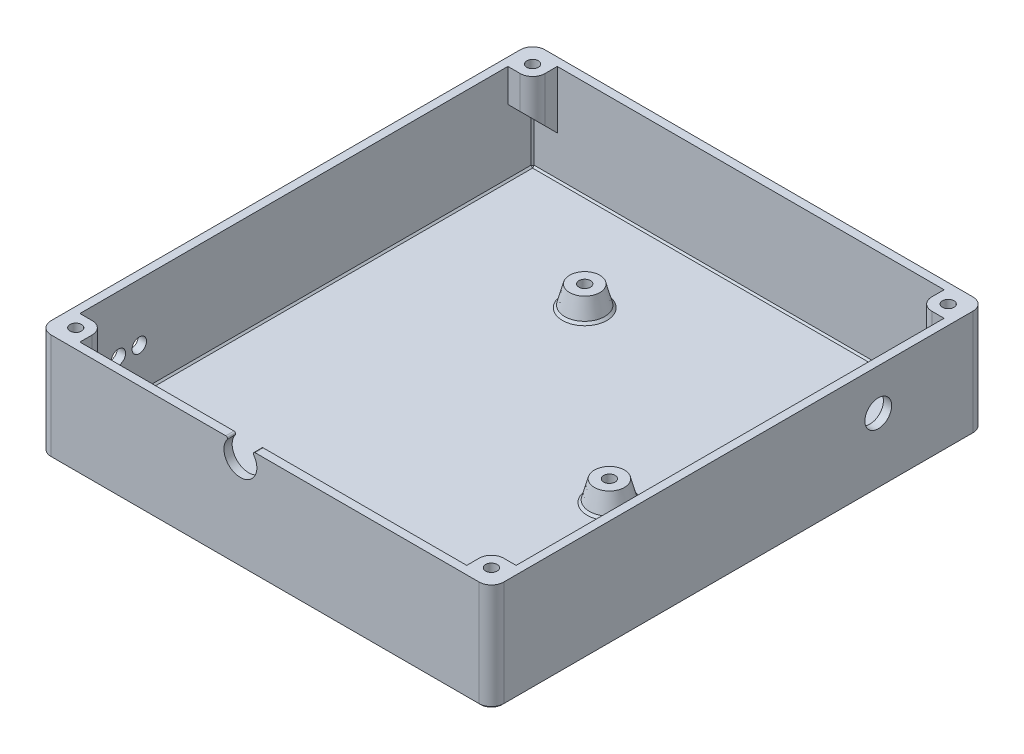
from build123d import *
from OCP.BRepFilletAPI import BRepFilletAPI_MakeChamfer

# Parameters (mm, degrees)
SKETCH_1_W                = 110
SKETCH_1_H                = 120
EXTRUDE_1_DEPTH           = 2
SKETCH_2_R                = 5
EXTRUDE_2_DEPTH           = 5
EXTRUDE_2_DRAFT           = 15
EXTRUDE_2_PROFILE_2_DEPTH = 5
EXTRUDE_2_PROFILE_2_DRAFT = 15
EXTRUDE_2_PROFILE_3_DEPTH = 5
EXTRUDE_2_PROFILE_3_DRAFT = 15
SKETCH_3_R                = 1.4
CUT_EXTRUDE_1_DEPTH       = 5
SKETCH_4_W                = 110
SKETCH_4_H                = 120
SKETCH_4_W_2              = 106
SKETCH_4_H_2              = 116
EXTRUDE_3_DEPTH           = 24
SKETCH_5_W                = 6
SKETCH_5_H                = 6
EXTRUDE_4_DEPTH           = 8
CHAMFER_1_SIZE            = 6
SKETCH_6_R                = 1.4
CUT_EXTRUDE_2_DEPTH       = 8
FILLET_1_R                = 3
CHAMFER_2_SIZE            = 0.4
CHAMFER_3_SIZE            = 0.4
CHAMFER_3_SIZE2           = 0.565685425
SKETCH_8_R                = 4
CUT_EXTRUDE_3_DEPTH       = 3
FILLET_2_R                = 0.4
SKETCH_9_R                = 3.25
CUT_EXTRUDE_4_DEPTH       = 10
SKETCH_10_R               = 1.75
CUT_EXTRUDE_5_DEPTH       = 10


with BuildPart() as part:
    # 草图1 → 凸台-拉伸1 (new body)
    with BuildSketch(Plane(origin=(0, 0, 0), x_dir=(1, 0, 0), z_dir=(0, 1, 0))):
        with Locations((55, 60)):
            Rectangle(SKETCH_1_W, SKETCH_1_H)
    extrude(amount=EXTRUDE_1_DEPTH)


with BuildPart() as extrude_2_tool:
    # 草图2 → 凸台-拉伸2 (with draft: the straight prism first)
    with BuildSketch(Plane(origin=(0, 2, 0), x_dir=(1, 0, 0), z_dir=(0, 1, 0))):
        with Locations((82.1, 56.57)):
            Circle(SKETCH_2_R)
    extrude(amount=EXTRUDE_2_DEPTH)
    # 凸台-拉伸2: the draft: its side faces are tilted about the plane it starts from
    extrude_2_sides = [extrude_2_tool.faces().sort_by_distance(p)[0] for p in [
        (77.1, 4.5, -56.57),
    ]]
    draft(extrude_2_sides, Plane(origin=(0, 2, 0), x_dir=(1, 0, 0), z_dir=(0, 1, 0)), EXTRUDE_2_DRAFT)


with BuildPart() as part_1:
    add(part.part)

    # 凸台-拉伸2: add extrude_2_tool
    add(extrude_2_tool.part)


with BuildPart() as extrude_2_profile_2_tool:
    # 草图2 → 凸台-拉伸2 profile 2 (with draft: the straight prism first)
    with BuildSketch(Plane(origin=(0, 2, 0), x_dir=(1, 0, 0), z_dir=(0, 1, 0))):
        with Locations((38.1, 94.57)):
            Circle(SKETCH_2_R)
    extrude(amount=EXTRUDE_2_PROFILE_2_DEPTH)
    # 凸台-拉伸2 profile 2: the draft: its side faces are tilted about the plane it starts from
    extrude_2_profile_2_sides = [extrude_2_profile_2_tool.faces().sort_by_distance(p)[0] for p in [
        (33.1, 4.5, -94.57),
    ]]
    draft(extrude_2_profile_2_sides, Plane(origin=(0, 2, 0), x_dir=(1, 0, 0), z_dir=(0, 1, 0)), EXTRUDE_2_PROFILE_2_DRAFT)


with BuildPart() as part_2:
    add(part_1.part)

    # 凸台-拉伸2 profile 2: add extrude_2_profile_2_tool
    add(extrude_2_profile_2_tool.part)


with BuildPart() as extrude_2_profile_3_tool:
    # 草图2 → 凸台-拉伸2 profile 3 (with draft: the straight prism first)
    with BuildSketch(Plane(origin=(0, 2, 0), x_dir=(1, 0, 0), z_dir=(0, 1, 0))):
        with Locations((23.1, 13.57)):
            Circle(SKETCH_2_R)
    extrude(amount=EXTRUDE_2_PROFILE_3_DEPTH)
    # 凸台-拉伸2 profile 3: the draft: its side faces are tilted about the plane it starts from
    extrude_2_profile_3_sides = [extrude_2_profile_3_tool.faces().sort_by_distance(p)[0] for p in [
        (18.1, 4.5, -13.57),
    ]]
    draft(extrude_2_profile_3_sides, Plane(origin=(0, 2, 0), x_dir=(1, 0, 0), z_dir=(0, 1, 0)), EXTRUDE_2_PROFILE_3_DRAFT)


with BuildPart() as part_3:
    add(part_2.part)

    # 凸台-拉伸2 profile 3: add extrude_2_profile_3_tool
    add(extrude_2_profile_3_tool.part)

    # 草图3 → 切除-拉伸1 (cut)
    with BuildSketch(Plane(origin=(0, 7, 0), x_dir=(1, 0, 0), z_dir=(0, 1, 0))):
        with Locations(Location((82.1, 56.57, 0), (0, 0, 270))):
            Circle(SKETCH_3_R)
        with Locations(Location((38.1, 94.57, 0), (0, 0, 270))):
            Circle(SKETCH_3_R)
        with Locations(Location((23.1, 13.57, 0), (0, 0, 270))):
            Circle(SKETCH_3_R)
    extrude(amount=-CUT_EXTRUDE_1_DEPTH, mode=Mode.SUBTRACT)

    # 草图4 → 凸台-拉伸3 (add)
    with BuildSketch(Plane(origin=(0, 2, 0), x_dir=(1, 0, 0), z_dir=(0, 1, 0))):
        with Locations((55, 60)):
            Rectangle(SKETCH_4_W, SKETCH_4_H)
        with Locations((55, 60)):
            Rectangle(SKETCH_4_W_2, SKETCH_4_H_2, mode=Mode.SUBTRACT)
    extrude(amount=EXTRUDE_3_DEPTH)

    # 草图5 → 凸台-拉伸4 (add)
    with BuildSketch(Plane(origin=(0, 26, 0), x_dir=(1, 0, 0), z_dir=(0, 1, 0))):
        with Locations((5, 115)):
            Rectangle(SKETCH_5_W, SKETCH_5_H)
        with Locations((105, 115)):
            Rectangle(SKETCH_5_W, SKETCH_5_H)
        with Locations((105, 5)):
            Rectangle(SKETCH_5_W, SKETCH_5_H)
        with Locations((5, 5)):
            Rectangle(SKETCH_5_W, SKETCH_5_H)
    extrude(amount=-EXTRUDE_4_DEPTH)

    # 倒角1
    chamfer_1_edges = [part_3.edges().sort_by_distance(p)[0] for p in [
        (105, 18, -118),
        (5, 18, -118),
        (105, 18, -2),
        (5, 18, -2),
    ]]
    chamfer(chamfer_1_edges, length=CHAMFER_1_SIZE - 0.0001)  # a hair under: the kernel refuses the full size

    # 草图6 → 切除-拉伸2 (cut)
    with BuildSketch(Plane(origin=(0, 26, 0), x_dir=(1, 0, 0), z_dir=(0, 1, 0))):
        with Locations(Location((4.5, 115.5, 0), (0, 0, 270))):
            Circle(SKETCH_6_R)
        with Locations(Location((105.5, 115.5, 0), (0, 0, 270))):
            Circle(SKETCH_6_R)
        with Locations(Location((105.5, 4.5, 0), (0, 0, 270))):
            Circle(SKETCH_6_R)
        with Locations(Location((4.5, 4.5, 0), (0, 0, 270))):
            Circle(SKETCH_6_R)
    extrude(amount=-CUT_EXTRUDE_2_DEPTH, mode=Mode.SUBTRACT)

    # 圆角1
    fillet_1_edges = [part_3.edges().sort_by_distance(p)[0] for p in [
        (8, 22, -8),
        (8, 22, -112),
        (102, 22, -112),
        (0, 13, -120),
        (110, 13, -120),
        (110, 13, 0),
        (0, 13, 0),
        (102, 22, -8),
    ]]
    fillet(fillet_1_edges, radius=FILLET_1_R)

    # 倒角2
    chamfer_2_edges = [part_3.edges().sort_by_distance(p)[0] for p in [
        (55, 0, 0),
        (0, 0, -60),
        (55, 0, -120),
        (110, 0, -60),
        (0.878679656, 0, -119.121320344),
        (109.121320344, 0, -119.121320344),
        (109.121320344, 0, -0.878679656),
        (0.878679656, 0, -0.878679656),
    ]]
    chamfer(chamfer_2_edges, length=CHAMFER_2_SIZE)

    # 倒角3: one chamfer whose edges measure the first distance from different faces: ONE call of the kernel's chamfer builder (chamfer() names one face for all edges)
    chamfer_3_edges_1 = [part_3.edges().sort_by_distance(p)[0] for p in [
        (2, 7.00005, -118),
        (108, 7.00005, -118),
        (108, 7.00005, -2),
        (2, 7.00005, -2),
        (55, 2, -118),
        (2, 2, -60),
        (55, 2, -2),
        (108, 2, -60),
    ]]
    chamfer_3_edges_2 = [part_3.edges().sort_by_distance(p)[0] for p in [
        (77.1, 2, -56.57),
        (33.1, 2, -94.57),
        (18.1, 2, -13.57),
    ]]
    chamfer_3_side_2 = [part_3.faces().sort_by_distance(p)[0] for p in [
        (55.141315111, 2, -60.099571799),
    ]]
    chamfer_3 = BRepFilletAPI_MakeChamfer(part_3.part.solid().wrapped)
    for e in chamfer_3_edges_1:
        chamfer_3.Add(CHAMFER_3_SIZE, e.wrapped)
    for e in chamfer_3_edges_2:
        chamfer_3.Add(CHAMFER_3_SIZE, CHAMFER_3_SIZE2, e.wrapped, chamfer_3_side_2[0].wrapped)  # the first distance lies on this face
    add(Compound.cast(chamfer_3.Shape()), mode=Mode.REPLACE)

    # 草图8 → 切除-拉伸3 (cut)
    with BuildSketch(Plane.XY):
        with Locations((49, 23)):
            Circle(SKETCH_8_R)
    extrude(amount=-CUT_EXTRUDE_3_DEPTH, mode=Mode.SUBTRACT)

    # 圆角2
    fillet_2_edges = [part_3.edges().sort_by_distance(p)[0] for p in [
        (46.354248689, 26, -1),
        (51.645751311, 26, -1),
    ]]
    fillet(fillet_2_edges, radius=FILLET_2_R)

    # 草图9 → 切除-拉伸4 (cut)
    with BuildSketch(Plane.ZY.offset(-108)):
        with Locations((-94, 16)):
            Circle(SKETCH_9_R)
    extrude(amount=-CUT_EXTRUDE_4_DEPTH, mode=Mode.SUBTRACT)

    # 草图10 → 切除-拉伸5 (cut)
    with BuildSketch(Plane(origin=(2, 0, 0), x_dir=(0, 0, -1), z_dir=(1, 0, 0))):
        with Locations((22.430011451, 12.100047346)):
            Circle(SKETCH_10_R)
        with Locations((17.350013958, 12.100047346)):
            Circle(SKETCH_10_R)
    extrude(amount=-CUT_EXTRUDE_5_DEPTH, mode=Mode.SUBTRACT)


solid = part_3.part
